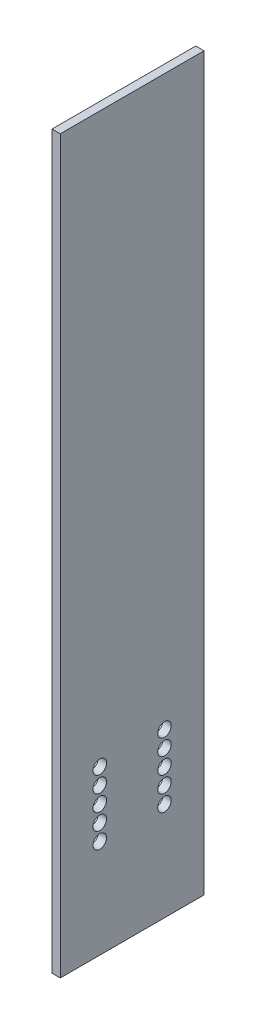
from build123d import *

# Parameters (mm, degrees)
SKETCH1_W                  = 56.4388
SKETCH1_H                  = 287.02
BOSS_EXTRUDE1_DEPTH        = 3.2512
F_4_0_209_DIAMETER_HOLE1_D = 5.3086
LPATTERN1_COUNT            = 4
LPATTERN1_PITCH            = 6.35
LPATTERN1_COL_COUNT        = 2
LPATTERN1_COL_PITCH        = 6.35


with BuildPart() as part:
    # Sketch1 → Boss-Extrude1 (new body)
    with BuildSketch(Plane(origin=(0, 0, 0), x_dir=(0, 0, -1), z_dir=(1, 0, 0))):
        Rectangle(SKETCH1_W, SKETCH1_H)
    extrude(amount=BOSS_EXTRUDE1_DEPTH)

    # #4 (0.209) Diameter Hole1 (through all)
    with Locations(Plane.ZY):
        with Locations((-12.7, -98.5012), (12.7, -98.5012)):
            f_4_0_209_diameter_hole1 = Hole(F_4_0_209_DIAMETER_HOLE1_D / 2)

    # LPattern1: #4 (0.209) Diameter Hole1 ×4
    with Locations(*[(0, i * LPATTERN1_PITCH, 0) for i in range(1, LPATTERN1_COUNT)]):
        add(f_4_0_209_diameter_hole1, mode=Mode.SUBTRACT)

    # LPattern1 col: #4 (0.209) Diameter Hole1 ×2
    with Locations(*[(0, -i * LPATTERN1_COL_PITCH, 0) for i in range(1, LPATTERN1_COL_COUNT)]):
        add(f_4_0_209_diameter_hole1, mode=Mode.SUBTRACT)


solid = part.part
